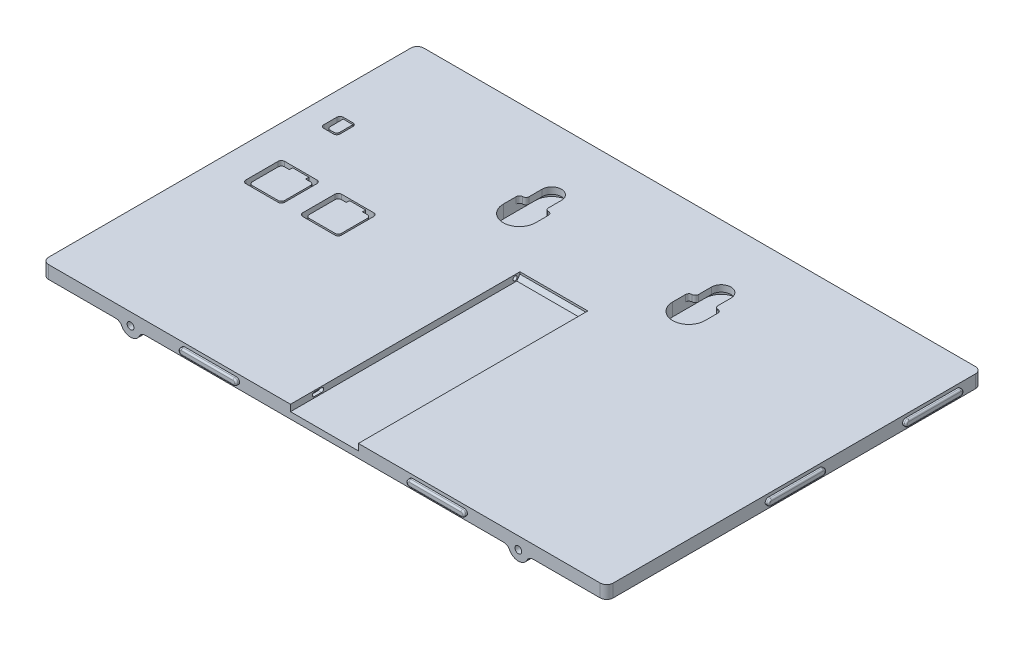
from build123d import *

# Parameters (mm, degrees)
BOSS_EXTRUDE1_DEPTH             = 4
FILLET1_R                       = 2
CUT_EXTRUDE1_DEPTH              = 2
SKETCH5_R                       = 3.0499999999999914
SKETCH5_R_2                     = 1.050000000000002
BOSS_EXTRUDE2_DEPTH             = 9
FILLET2_R                       = 2
CUT_EXTRUDE2_DEPTH              = 11
FILLET3_R                       = 2
FILLET2_OF_MIRROR1_R            = 2
FILLET3_OF_MIRROR1_R            = 2
CUT_EXTRUDE4_DEPTH              = 106.0829687697655
CUT_EXTRUDE6_START              = -4
CUT_EXTRUDE6_DEPTH              = 2.5
SKETCH6_5_R                     = 3.550000000000004
SKETCH6_5_R_2                   = 3.549999999999997
BOSS_EXTRUDE3_DEPTH             = 5.41
SKETCH6_6_W                     = 11.999999999999986
SKETCH6_6_H                     = 12
SKETCH6_6_W_2                   = 12
SKETCH6_6_H_2                   = 11.999999999999993
BOSS_EXTRUDE4_DEPTH             = 5.41
SKETCH6_7_W                     = 9.999999999999972
SKETCH6_7_H                     = 9.999999999999991
SKETCH6_7_R                     = 3.550000000000004
SKETCH6_7_W_2                   = 10
SKETCH6_7_H_2                   = 9.999999999999993
SKETCH6_7_R_2                   = 3.549999999999997
CUT_EXTRUDE9_DEPTH              = 0.5
FILLET4_R                       = 1
FILLET5_R                       = 0.25
CUT_EXTRUDE7_DEPTH              = 106.0829687697655
CUT_EXTRUDE8_START              = -2
SKETCH7_3_W                     = 2.999999999999986
SKETCH7_3_H                     = 1
CUT_EXTRUDE8_DEPTH              = 0.5
BOSS_EXTRUDE5_DEPTH             = 3.62
SKETCH7_5_W                     = 2.999999999999986
SKETCH7_5_H                     = 1
CUT_EXTRUDE10_DEPTH             = 0.5
SKETCH7_6_W                     = 7
SKETCH7_6_H                     = 8.000000000000007
SKETCH7_6_W_2                   = 5
SKETCH7_6_H_2                   = 6.000000000000007
BOSS_EXTRUDE6_DEPTH             = 3.62
FILLET6_START                   = -1
FILLET6_DEPTH                   = 3
FILLET6_START_2                 = 1.8288956
FILLET6_2_DEPTH                 = 1.78876
FILLET6_3_DEPTH                 = 0.6711044
FILLET6_START_3                 = 0.38
FILLET6_4_DEPTH                 = 3.62
FILLET7_R                       = 0.25
BOSS_EXTRUDE7_DEPTH             = 6
CUT_EXTRUDE11_DEPTH             = 4
CUT_EXTRUDE12_START             = -2
CUT_EXTRUDE12_DEPTH             = 2
FILLET8_R                       = 1
FILLET9_R                       = 2
FILLET8_OF_MIRROR2_R            = 1
FILLET9_OF_MIRROR2_R            = 2
CUT_EXTRUDE13_DEPTH             = 2
CUT_EXTRUDE14_START             = -10.5
SKETCH10_R                      = 0.6250000000000004
CUT_EXTRUDE14_DEPTH             = 1
CUT_EXTRUDE15_START             = 11.5
SKETCH10_2_R                    = 0.6250000000000004
CUT_EXTRUDE15_DEPTH             = 1
BOSS_EXTRUDE8_REACH             = 106.939
BOSS_EXTRUDE8_DIRECTION_2_REACH = 106.939
CUT_EXTRUDE16_START             = -10.5
CUT_EXTRUDE16_DEPTH             = 1
BOSS_EXTRUDE9_DEPTH             = 1
BOSS_EXTRUDE10_DEPTH            = 1
BOSS_EXTRUDE11_START            = 1
BOSS_EXTRUDE11_DEPTH            = 1
BOSS_EXTRUDE12_DEPTH            = 1
FILLET11_R                      = 0.5


with BuildPart() as part:
    # Sketch3 → Boss-Extrude1 (new body)
    with BuildSketch(Plane(origin=(0, 0, 0), x_dir=(1, 0, 0), z_dir=(0, 1, 0))):
        Polygon((-87.33750000000002, 58.0375), (87.33749999999999, 58.0375), (87.33750000000003, -58.037500000000016), (-87.33749999999999, -58.037500000000016), align=None)
    extrude(amount=BOSS_EXTRUDE1_DEPTH)

    # Fillet1
    fillet1_edges = [part.edges().sort_by_distance(p)[0] for p in [
        (87.33750000000003, 2, 58.037500000000016),
        (-87.33749999999999, 2, 58.037500000000016),
        (-87.33750000000002, 2, -58.0375),
        (87.33749999999999, 2, -58.0375),
    ]]
    fillet(fillet1_edges, radius=FILLET1_R)

    # Sketch4 → Cut-Extrude1 (cut)
    with BuildSketch(Plane(origin=(0, 0, 0), x_dir=(1, 0, 0), z_dir=(0, 1, 0))):
        with BuildLine():
            Line((-87.33750000000002, 41.2375), (-36.27500000000002, 41.2375))
            ThreePointArc((-36.27500000000002, 41.2375), (-35.52369904498932, 40.92630095501071), (-35.21250000000004, 40.17500000000001))
            Line((-35.21250000000004, 40.17500000000001), (-35.21250000000003, 14.299999999999981))
            ThreePointArc((-35.21250000000003, 14.299999999999981), (-35.523699044989314, 13.548699044989284), (-36.27500000000001, 13.237499999999995))
            Line((-36.27500000000001, 13.237499999999995), (-87.33750000000002, 13.237499999999995))
            Line((-87.33750000000002, 13.237499999999995), (-87.33750000000002, 41.2375))
        make_face()
    extrude(amount=CUT_EXTRUDE1_DEPTH, mode=Mode.SUBTRACT)

    # Sketch5 → Boss-Extrude2 (add)
    with BuildSketch(Plane.XY.offset(58.037500000000016)):
        with Locations((60, 0.2500000000000002)):
            Circle(SKETCH5_R)
        with Locations((60, 0.2500000000000002)):
            Circle(SKETCH5_R_2, mode=Mode.SUBTRACT)
    boss_extrude2 = extrude(amount=-BOSS_EXTRUDE2_DEPTH)

    # Fillet2
    # the kernel refuses this fillet: 2 mm, written as the material it adds along each edge
    with BuildSketch(Plane(origin=(63.980196097281436, 0, 49.037500000000016), x_dir=(0, 0, -1), z_dir=(-1, 0, 0))) as fillet2_piece_1_section:
        with BuildLine():
            CenterArc((FILLET2_R, FILLET2_R), FILLET2_R, 180, 90)
            Line((0, FILLET2_R), (0, 0))
            Line((0, 0), (FILLET2_R, 0))
        make_face()
    fillet2_piece_1 = extrude(amount=12.019932927995562, mode=Mode.PRIVATE)
    fillet2_piece_1 = fillet2_piece_1 & Plane(origin=(60, 0.2500000000000002, 49.037500000000016), x_dir=(1, 0, 0), z_dir=(0, 0, 1)) * Cylinder(3.0499999999999914, 33, mode=Mode.PRIVATE)
    fillet2_piece_1 = fillet2_piece_1 - Plane(origin=(60, 0.2500000000000002, 49.037500000000016), x_dir=(1, 0, 0), z_dir=(0, 0, 1)) * Cylinder(1.050000000000002, 33, mode=Mode.PRIVATE)
    add(fillet2_piece_1)
    with BuildSketch(Plane(origin=(68.03973683071413, 0, 49.037500000000016), x_dir=(0, 0, -1), z_dir=(-1, 0, 0))) as fillet2_piece_2_section:
        with BuildLine():
            CenterArc((FILLET2_R, FILLET2_R), FILLET2_R, 180, 90)
            Line((0, FILLET2_R), (0, 0))
            Line((0, 0), (FILLET2_R, 0))
        make_face()
    fillet2_piece_2 = extrude(amount=12.019932927995583, mode=Mode.PRIVATE)
    fillet2_piece_2 = fillet2_piece_2 - Plane(origin=(60, 0.2500000000000002, 49.037500000000016), x_dir=(1, 0, 0), z_dir=(0, 0, 1)) * Cylinder(1.050000000000002, 33, mode=Mode.PRIVATE)
    fillet2_piece_2 = fillet2_piece_2 & Plane(origin=(60, 0.2500000000000002, 49.037500000000016), x_dir=(1, 0, 0), z_dir=(0, 0, 1)) * Cylinder(3.0499999999999914, 33, mode=Mode.PRIVATE)
    add(fillet2_piece_2)

    # Sketch5<6> → Cut-Extrude2 (cut)
    with BuildSketch(Plane.XY.offset(58.037500000000016)):
        with BuildLine():
            ThreePointArc((61.01980390271856, 4.4e-16), (61.042423641772984, 0.12409149721818807), (61.050000000000004, 0.24999999999999997))
            ThreePointArc((61.050000000000004, 0.2500000000000002), (59.87409149721818, 1.2924236417729813), (58.98019609728144, -1.638e-14))
            Line((58.98019609728145, 0), (61.01980390271855, 0))
        make_face()
        with BuildLine():
            Line((61.01980390271855, 0), (58.98019609728145, 0))
            ThreePointArc((58.98019609728144, -1.638e-14), (60.00000000000001, -0.8000000000000018), (61.01980390271856, 4.4e-16))
        make_face()
    cut_extrude2 = extrude(amount=-CUT_EXTRUDE2_DEPTH, mode=Mode.SUBTRACT)

    # Fillet3
    fillet3_edges = [part.edges().sort_by_distance(p)[0] for p in [
        (56.960263169285945, -1.12e-14, 52.53750000000001),
        (63.03973683071405, -5.129e-14, 52.53750000000001),
    ]]
    fillet(fillet3_edges, radius=FILLET3_R)

    # Mirror1: Boss-Extrude2, Cut-Extrude2 across plane
    add(boss_extrude2.mirror(Plane(origin=(0, 0, 0), x_dir=(3e-16, 0, 1), z_dir=(1, 0, -3e-16))))
    add(cut_extrude2.mirror(Plane(origin=(0, 0, 0), x_dir=(3e-16, 0, 1), z_dir=(1, 0, -3e-16))), mode=Mode.SUBTRACT)

    # Fillet2 of Mirror1
    # the kernel refuses this fillet: 2 mm, written as the material it adds along each edge
    with BuildSketch(Plane(origin=(-63.980196097281414, 0, 49.03750000000006), x_dir=(0, -1, 0), z_dir=(1, 0, -6e-16))) as fillet2_of_mirror1_piece_1_section:
        with BuildLine():
            CenterArc((FILLET2_OF_MIRROR1_R, FILLET2_OF_MIRROR1_R), FILLET2_OF_MIRROR1_R, 180, 90)
            Line((0, FILLET2_OF_MIRROR1_R), (0, 0))
            Line((0, 0), (FILLET2_OF_MIRROR1_R, 0))
        make_face()
    fillet2_of_mirror1_piece_1 = extrude(amount=12.01993292799557, mode=Mode.PRIVATE)
    fillet2_of_mirror1_piece_1 = fillet2_of_mirror1_piece_1 - Plane(origin=(-60.000000000000234, 0.249999999999986, 49.03750000000006), x_dir=(-0.9712418121129005, -0.238095238095283, 0), z_dir=(6e-16, 0, 1)) * Cylinder(1.0499999999997416, 33, mode=Mode.PRIVATE)
    fillet2_of_mirror1_piece_1 = fillet2_of_mirror1_piece_1 & Plane(origin=(-59.99999999999997, 0.2500000000000002, 49.03750000000006), x_dir=(-1, 0, 6e-16), z_dir=(6e-16, 0, 1)) * Cylinder(3.0499999999999914, 33, mode=Mode.PRIVATE)
    add(fillet2_of_mirror1_piece_1)
    with BuildSketch(Plane(origin=(-68.0397368307141, 0, 49.03750000000006), x_dir=(0, -1, -3.55e-15), z_dir=(1, 0, -6e-16))) as fillet2_of_mirror1_piece_2_section:
        with BuildLine():
            CenterArc((FILLET2_OF_MIRROR1_R, FILLET2_OF_MIRROR1_R), FILLET2_OF_MIRROR1_R, 180, 89.99999999999977)
            Line((7.11e-15, FILLET2_OF_MIRROR1_R), (0, 0))
            Line((0, 0), (FILLET2_OF_MIRROR1_R, 0))
        make_face()
    fillet2_of_mirror1_piece_2 = extrude(amount=12.019932927995576, mode=Mode.PRIVATE)
    fillet2_of_mirror1_piece_2 = fillet2_of_mirror1_piece_2 - Plane(origin=(-60.000000000000234, 0.249999999999986, 49.03750000000005), x_dir=(-0.9712418121129005, -0.238095238095283, 0), z_dir=(6e-16, 0, 1)) * Cylinder(1.0499999999997416, 33, mode=Mode.PRIVATE)
    fillet2_of_mirror1_piece_2 = fillet2_of_mirror1_piece_2 & Plane(origin=(-59.99999999999997, 0.2500000000000002, 49.03750000000005), x_dir=(-1, 0, 6e-16), z_dir=(6e-16, 0, 1)) * Cylinder(3.0499999999999914, 33, mode=Mode.PRIVATE)
    add(fillet2_of_mirror1_piece_2)

    # Fillet3 of Mirror1
    fillet3_of_mirror1_edges = [part.edges().sort_by_distance(p)[0] for p in [
        (-56.960263169285916, -1.12e-14, 52.537500000000044),
        (-63.03973683071402, -5.129e-14, 52.537500000000044),
    ]]
    fillet(fillet3_of_mirror1_edges, radius=FILLET3_OF_MIRROR1_R)

    # Sketch6 → Cut-Extrude4 (cut, through all)
    with BuildSketch(Plane(origin=(0, 4, 0), x_dir=(1, 0, 0), z_dir=(0, 1, 0))):
        Polygon((-74.01750000000006, 6.152499999999987), (-77.51750000000003, 6.152499999999987), (-77.51750000000003, -5.847500000000013), (-65.51750000000004, -5.847500000000013), (-65.51750000000004, 6.152499999999987), (-69.01750000000004, 6.152499999999987), (-69.01750000000004, 5.152499999999988), (-66.51750000000006, 5.152499999999987), (-66.51750000000006, -4.847500000000004), (-76.51750000000003, -4.847500000000004), (-76.51750000000003, 5.152499999999987), (-74.01750000000006, 5.152499999999987), align=None)
        Polygon((-56.427500000000016, 6.152499999999982), (-59.92750000000002, 6.152499999999982), (-59.92750000000002, -5.847500000000013), (-47.92750000000002, -5.847500000000012), (-47.92750000000002, 6.152499999999982), (-51.42750000000003, 6.152499999999982), (-51.42750000000003, 5.152499999999985), (-48.92750000000002, 5.152499999999982), (-48.92750000000002, -4.847500000000011), (-58.92750000000002, -4.847500000000012), (-58.92750000000002, 5.152499999999982), (-56.427500000000016, 5.152499999999982), align=None)
    extrude(amount=-CUT_EXTRUDE4_DEPTH, mode=Mode.SUBTRACT)

    # Sketch6<4> → Cut-Extrude6 (cut)
    with BuildSketch(Plane(origin=(0, 4, 0), x_dir=(1, 0, 0), z_dir=(0, 1, 0)).offset(CUT_EXTRUDE6_START)):
        Polygon((-69.01750000000004, 6.152499999999987), (-74.01750000000006, 6.152499999999987), (-74.01750000000006, 5.1524999999999865), (-69.01750000000004, 5.152499999999987), align=None)
        Polygon((-51.42750000000003, 6.152499999999982), (-56.427500000000016, 6.152499999999982), (-56.427500000000016, 5.152499999999983), (-51.42750000000003, 5.152499999999982), align=None)
    extrude(amount=CUT_EXTRUDE6_DEPTH, mode=Mode.SUBTRACT)

    # Sketch6<5> → Boss-Extrude3 (add)
    with BuildSketch(Plane(origin=(0, 4, 0), x_dir=(1, 0, 0), z_dir=(0, 1, 0))):
        with Locations(Location((-71.51750000000004, 0.15249999999998598, 0), (0, 0, 270))):
            Circle(SKETCH6_5_R)
        with Locations(Location((-53.92750000000002, 0.15249999999998426, 0), (0, 0, 270))):
            Circle(SKETCH6_5_R_2)
    extrude(amount=-BOSS_EXTRUDE3_DEPTH)

    # Sketch6<6> → Boss-Extrude4 (add)
    # profile 1 of 2: a face of its own
    with BuildSketch(Plane(origin=(0, 4, 0), x_dir=(1, 0, 0), z_dir=(0, 1, 0))):
        Polygon((-64.51750000000003, 7.152499999999879), (-64.51750000000003, -6.847499999999877), (-78.51749999999994, -6.847499999999878), (-78.51749999999994, 7.152499999999879), align=None)
        with Locations((-71.51750000000004, 0.15249999999998787)):
            Rectangle(SKETCH6_6_W, SKETCH6_6_H, mode=Mode.SUBTRACT)
    # profile 2 of 2: a face of its own
    with BuildSketch(Plane(origin=(0, 4, 0), x_dir=(1, 0, 0), z_dir=(0, 1, 0))):
        Polygon((-46.92750000000002, 7.152499999999876), (-46.92750000000002, -6.847499999999877), (-60.92749999999995, -6.847499999999877), (-60.92749999999995, 7.152499999999877), align=None)
        with Locations((-53.92750000000002, 0.1524999999999852)):
            Rectangle(SKETCH6_6_W_2, SKETCH6_6_H_2, mode=Mode.SUBTRACT)
    extrude(amount=-BOSS_EXTRUDE4_DEPTH)

    # Sketch6<7> → Cut-Extrude9 (cut)
    # profile 1 of 6: a face of its own
    with BuildSketch(Plane(origin=(0, 4, 0), x_dir=(1, 0, 0), z_dir=(0, 1, 0))):
        with Locations((-71.51750000000004, 0.15249999999999186)):
            Rectangle(SKETCH6_7_W, SKETCH6_7_H)
        with Locations(Location((-71.51750000000004, 0.15249999999998598, 0), (0, 0, 270))):
            Circle(SKETCH6_7_R, mode=Mode.SUBTRACT)
    # profile 2 of 6: a face of its own
    with BuildSketch(Plane(origin=(0, 4, 0), x_dir=(1, 0, 0), z_dir=(0, 1, 0))):
        with Locations(Location((-71.51750000000004, 0.15249999999998598, 0), (0, 0, 270))):
            Circle(SKETCH6_7_R)
    # profile 3 of 6: a face of its own
    with BuildSketch(Plane(origin=(0, 4, 0), x_dir=(1, 0, 0), z_dir=(0, 1, 0))):
        with Locations((-53.92750000000002, 0.1524999999999852)):
            Rectangle(SKETCH6_7_W_2, SKETCH6_7_H_2)
        with Locations(Location((-53.92750000000002, 0.15249999999998426, 0), (0, 0, 270))):
            Circle(SKETCH6_7_R_2, mode=Mode.SUBTRACT)
    # profile 4 of 6: a face of its own
    with BuildSketch(Plane(origin=(0, 4, 0), x_dir=(1, 0, 0), z_dir=(0, 1, 0))):
        with Locations(Location((-53.92750000000002, 0.15249999999998426, 0), (0, 0, 270))):
            Circle(SKETCH6_7_R_2)
    # profile 5 of 6: a face of its own
    with BuildSketch(Plane(origin=(0, 4, 0), x_dir=(1, 0, 0), z_dir=(0, 1, 0))):
        Polygon((-51.42750000000003, 6.152499999999982), (-56.427500000000016, 6.152499999999982), (-56.427500000000016, 5.152499999999983), (-51.42750000000003, 5.152499999999982), align=None)
    # profile 6 of 6: a face of its own
    with BuildSketch(Plane(origin=(0, 4, 0), x_dir=(1, 0, 0), z_dir=(0, 1, 0))):
        Polygon((-69.01750000000004, 6.152499999999987), (-74.01750000000006, 6.152499999999987), (-74.01750000000006, 5.1524999999999865), (-69.01750000000004, 5.152499999999987), align=None)
    extrude(amount=-CUT_EXTRUDE9_DEPTH, mode=Mode.SUBTRACT)

    # Fillet4
    fillet4_edges = [part.edges().sort_by_distance(p)[0] for p in [
        (-76.51750000000003, 1.75, -5.152499999999987),
        (-76.51750000000003, 1.75, 4.847500000000004),
        (-66.51750000000006, 1.75, 4.847500000000004),
        (-66.51750000000006, 1.75, -5.152499999999987),
        (-65.51750000000004, 1.295, -6.152499999999987),
        (-65.51750000000004, 1.295, 5.847500000000013),
        (-77.51750000000003, 1.295, 5.847500000000013),
        (-77.51750000000003, 1.295, -6.152499999999987),
        (-47.92750000000002, 1.295, -6.152499999999982),
        (-47.92750000000002, 1.295, 5.847500000000011),
        (-59.92750000000002, 1.295, 5.847500000000013),
        (-59.92750000000002, 1.295, -6.152499999999982),
        (-58.92750000000002, 1.75, -5.152499999999982),
        (-58.92750000000002, 1.75, 4.847500000000011),
        (-48.92750000000002, 1.75, 4.847500000000011),
        (-48.92750000000002, 1.75, -5.152499999999982),
        (-64.51750000000003, -0.7050000000000001, -7.152499999999879),
        (-64.51750000000003, -0.7050000000000001, 6.847499999999877),
        (-78.51749999999994, -0.7050000000000001, 6.847499999999878),
        (-78.51749999999994, -0.7050000000000001, -7.152499999999879),
        (-46.92750000000002, -0.7050000000000001, -7.152499999999876),
        (-46.92750000000002, -0.7050000000000001, 6.847499999999877),
        (-60.92749999999995, -0.7050000000000001, 6.847499999999877),
        (-60.92749999999995, -0.7050000000000001, -7.152499999999877),
    ]]
    fillet(fillet4_edges, radius=FILLET4_R)

    # Fillet5
    fillet5_edges = [part.edges().sort_by_distance(p)[0] for p in [
        (-71.51750000000004, -1.4100000000000001, -3.70249999999999),
        (-53.92750000000002, -1.4100000000000001, -3.7024999999999815),
    ]]
    fillet(fillet5_edges, radius=FILLET5_R)

    # Sketch7 → Cut-Extrude7 (cut, through all)
    with BuildSketch(Plane(origin=(0, 4, 0), x_dir=(1, 0, 0), z_dir=(0, 1, 0))):
        Polygon((-79.25750000000002, 22.037499999999994), (-79.25750000000002, 26.037499999999998), (-79.25750000000002, 27.037499999999994), (-80.25750000000004, 27.037499999999994), (-80.25750000000004, 21.03749999999999), (-75.25750000000004, 21.03749999999999), (-75.25750000000004, 27.037499999999994), (-76.25750000000004, 27.037499999999994), (-76.25750000000004, 26.037499999999998), (-76.25750000000002, 22.03749999999999), align=None)
    extrude(amount=-CUT_EXTRUDE7_DEPTH, mode=Mode.SUBTRACT)

    # Sketch7<3> → Cut-Extrude8 (cut)
    with BuildSketch(Plane(origin=(0, 4, 0), x_dir=(1, 0, 0), z_dir=(0, 1, 0)).offset(CUT_EXTRUDE8_START)):
        with Locations((-77.75750000000002, 26.537499999999998)):
            Rectangle(SKETCH7_3_W, SKETCH7_3_H)
    extrude(amount=CUT_EXTRUDE8_DEPTH, mode=Mode.SUBTRACT)

    # Sketch7<4> → Boss-Extrude5 (add)
    with BuildSketch(Plane(origin=(0, 4, 0), x_dir=(1, 0, 0), z_dir=(0, 1, 0))):
        Polygon((-76.25750000000004, 26.037499999999998), (-76.25750000000002, 22.03749999999999), (-79.25750000000002, 22.037499999999994), (-79.25750000000002, 26.037499999999998), align=None)
    extrude(amount=-BOSS_EXTRUDE5_DEPTH)

    # Sketch7<5> → Cut-Extrude10 (cut)
    with BuildSketch(Plane(origin=(0, 4, 0), x_dir=(1, 0, 0), z_dir=(0, 1, 0))):
        Polygon((-76.25750000000004, 26.037499999999998), (-76.25750000000002, 22.03749999999999), (-79.25750000000002, 22.037499999999994), (-79.25750000000002, 26.037499999999998), align=None)
        with Locations((-77.75750000000002, 26.537499999999998)):
            Rectangle(SKETCH7_5_W, SKETCH7_5_H)
    extrude(amount=-CUT_EXTRUDE10_DEPTH, mode=Mode.SUBTRACT)

    # Sketch7<6> → Boss-Extrude6 (add)
    with BuildSketch(Plane(origin=(0, 4, 0), x_dir=(1, 0, 0), z_dir=(0, 1, 0))):
        with Locations((-77.75750000000004, 24.037499999999994)):
            Rectangle(SKETCH7_6_W, SKETCH7_6_H)
        with Locations((-77.75750000000004, 24.037499999999994)):
            Rectangle(SKETCH7_6_W_2, SKETCH7_6_H_2, mode=Mode.SUBTRACT)
    extrude(amount=-BOSS_EXTRUDE6_DEPTH)

    # Fillet6: read off the stored shape, not the designer's step
    # Fillet6 outline → Fillet6 (cut)
    with BuildSketch(Plane(origin=(0, 0, 0), x_dir=(1, 0, 0), z_dir=(0, 1, 0)).offset(FILLET6_START)):
        with BuildLine():
            Line((-76.2575, 26.0375), (-77.2575, 26.0375))
            ThreePointArc((-77.2575, 26.0375), (-76.550393219, 25.744606781), (-76.2575, 25.0375))
            Line((-76.2575, 25.0375), (-76.2575, 26.0375))
        make_face()
        with BuildLine():
            ThreePointArc((-79.2575, 25.0375), (-78.964606781, 25.744606781), (-78.2575, 26.0375))
            Line((-78.2575, 26.0375), (-79.2575, 26.0375))
            Line((-79.2575, 26.0375), (-79.2575, 25.0375))
        make_face()
        with BuildLine():
            Line((-76.2575, 22.0375), (-76.2575, 23.0375))
            ThreePointArc((-76.2575, 23.0375), (-76.550393219, 22.330393219), (-77.2575, 22.0375))
            Line((-77.2575, 22.0375), (-76.2575, 22.0375))
        make_face()
        with BuildLine():
            ThreePointArc((-78.2575, 22.0375), (-78.964606781, 22.330393219), (-79.2575, 23.0375))
            Line((-79.2575, 23.0375), (-79.2575, 22.0375))
            Line((-79.2575, 22.0375), (-78.2575, 22.0375))
        make_face()
        with BuildLine():
            Line((-74.2575, 20.0375), (-74.2575, 21.0375))
            ThreePointArc((-74.2575, 21.0375), (-74.550393219, 20.330393219), (-75.2575, 20.0375))
            Line((-75.2575, 20.0375), (-74.2575, 20.0375))
        make_face()
        with BuildLine():
            ThreePointArc((-75.2575, 28.0375), (-74.550393219, 27.744606781), (-74.2575, 27.0375))
            Line((-74.2575, 27.0375), (-74.2575, 28.0375))
            Line((-74.2575, 28.0375), (-75.2575, 28.0375))
        make_face()
        with BuildLine():
            Line((-81.2575, 20.0375), (-80.2575, 20.0375))
            ThreePointArc((-80.2575, 20.0375), (-80.964606781, 20.330393219), (-81.2575, 21.0375))
            Line((-81.2575, 21.0375), (-81.2575, 20.0375))
        make_face()
        with BuildLine():
            ThreePointArc((-81.2575, 27.0375), (-80.964606781, 27.744606781), (-80.2575, 28.0375))
            Line((-80.2575, 28.0375), (-81.2575, 28.0375))
            Line((-81.2575, 28.0375), (-81.2575, 27.0375))
        make_face()
    extrude(amount=FILLET6_DEPTH, mode=Mode.SUBTRACT)

    # Fillet6 2 outline → Fillet6 2 (cut)
    with BuildSketch(Plane(origin=(0, 0, 0), x_dir=(1, 0, 0), z_dir=(0, 1, 0)).offset(FILLET6_START_2)):
        with BuildLine():
            Line((-76.2575, 22.0375), (-76.2575, 23.0375))
            ThreePointArc((-76.2575, 23.0375), (-76.550393219, 22.330393219), (-77.2575, 22.0375))
            Line((-77.2575, 22.0375), (-76.2575, 22.0375))
        make_face()
        with BuildLine():
            ThreePointArc((-78.2575, 22.0375), (-78.964606781, 22.330393219), (-79.2575, 23.0375))
            Line((-79.2575, 23.0375), (-79.2575, 22.0375))
            Line((-79.2575, 22.0375), (-78.2575, 22.0375))
        make_face()
    extrude(amount=FILLET6_2_DEPTH, mode=Mode.SUBTRACT)

    # Fillet6 3 outline → Fillet6 3 (cut)
    with BuildSketch(Plane(origin=(0, 0, 0), x_dir=(1, 0, 0), z_dir=(0, 1, 0)).offset(FILLET6_START_2)):
        with BuildLine():
            Line((-76.2575, 26.0375), (-77.2575, 26.0375))
            ThreePointArc((-77.2575, 26.0375), (-76.550393219, 25.744606781), (-76.2575, 25.0375))
            Line((-76.2575, 25.0375), (-76.2575, 26.0375))
        make_face()
        with BuildLine():
            ThreePointArc((-79.2575, 25.0375), (-78.964606781, 25.744606781), (-78.2575, 26.0375))
            Line((-78.2575, 26.0375), (-79.2575, 26.0375))
            Line((-79.2575, 26.0375), (-79.2575, 25.0375))
        make_face()
    extrude(amount=FILLET6_3_DEPTH, mode=Mode.SUBTRACT)

    # Fillet6 4 outline → Fillet6 4 (add)
    with BuildSketch(Plane(origin=(0, 0, 0), x_dir=(1, 0, 0), z_dir=(0, 1, 0)).offset(FILLET6_START_3)):
        with BuildLine():
            Line((-75.2575, 27.0375), (-76.2575, 27.0375))
            ThreePointArc((-76.2575, 27.0375), (-75.550393219, 26.744606781), (-75.2575, 26.0375))
            Line((-75.2575, 26.0375), (-75.2575, 27.0375))
        make_face()
        with BuildLine():
            ThreePointArc((-80.2575, 26.0375), (-79.964606781, 26.744606781), (-79.2575, 27.0375))
            Line((-79.2575, 27.0375), (-80.2575, 27.0375))
            Line((-80.2575, 27.0375), (-80.2575, 26.0375))
        make_face()
        with BuildLine():
            Line((-75.2575, 21.0375), (-75.2575, 22.0375))
            ThreePointArc((-75.2575, 22.0375), (-75.550393219, 21.330393219), (-76.2575, 21.0375))
            Line((-76.2575, 21.0375), (-75.2575, 21.0375))
        make_face()
        with BuildLine():
            ThreePointArc((-79.2575, 21.0375), (-79.964606781, 21.330393219), (-80.2575, 22.0375))
            Line((-80.2575, 22.0375), (-80.2575, 21.0375))
            Line((-80.2575, 21.0375), (-79.2575, 21.0375))
        make_face()
    extrude(amount=FILLET6_4_DEPTH)

    # Fillet7
    fillet7_edges = [part.edges().sort_by_distance(p)[0] for p in [
        (-77.7575, 0.3799999999999999, -26.037499999999998),
        (-76.25750000000004, 0.3799999999999999, -24.0375),
        (-77.7575, 0.3799999999999999, -22.03749999999999),
        (-79.25750000000002, 0.3799999999999999, -24.0375),
        (-78.964606781, 0.3799999999999999, -22.330393218999998),
        (-76.550393219, 0.3799999999999999, -22.330393219000005),
        (-78.964606781, 0.3799999999999999, -25.744606781000005),
        (-76.550393219, 0.3799999999999999, -25.744606780999998),
    ]]
    fillet(fillet7_edges, radius=FILLET7_R)

    # Sketch8 → Boss-Extrude7 (add)
    # profile 1 of 5: a face of its own
    with BuildSketch(Plane(origin=(0, 4, 0), x_dir=(1, 0, 0), z_dir=(0, 1, 0))):
        with BuildLine():
            Line((-33.212500000000034, 38.5115161094887), (-33.212500000000034, 28.511516109488696))
            ThreePointArc((-33.212500000000034, 28.511516109488696), (-26.212499999999995, 21.511516109488657), (-19.21249999999996, 28.511516109488696))
            Line((-19.21249999999996, 28.511516109488696), (-19.21249999999996, 38.5115161094887))
            ThreePointArc((-19.21249999999996, 38.5115161094887), (-26.212499999999995, 45.51151610948874), (-33.212500000000034, 38.5115161094887))
        make_face()
        with BuildLine():
            ThreePointArc((-31.212499999999995, 28.511516109488696), (-26.212499999999995, 23.511516109488696), (-21.2125, 28.511516109488696))
            Line((-21.2125, 28.511516109488696), (-21.2125, 38.5115161094887))
            ThreePointArc((-21.2125, 38.5115161094887), (-26.2125, 43.511516109488696), (-31.212499999999995, 38.511516109488696))
            Line((-31.212499999999995, 38.511516109488696), (-31.212499999999995, 28.511516109488696))
        make_face(mode=Mode.SUBTRACT)
    # profile 2 of 5: a face of its own
    with BuildSketch(Plane(origin=(0, 4, 0), x_dir=(1, 0, 0), z_dir=(0, 1, 0))):
        with BuildLine():
            Line((-21.2125, 33.5115161094887), (-21.2125, 38.5115161094887))
            ThreePointArc((-21.212499999999995, 38.5115161094887), (-26.2125, 43.511516109488696), (-31.212499999999995, 38.511516109488696))
            Line((-31.212499999999995, 38.511516109488696), (-31.212499999999995, 33.5115161094887))
            Line((-31.212499999999995, 33.5115161094887), (-29.2125, 33.5115161094887))
            Line((-29.2125, 33.5115161094887), (-29.2125, 38.5115161094887))
            ThreePointArc((-29.2125, 38.5115161094887), (-26.2125, 41.5115161094887), (-23.2125, 38.5115161094887))
            Line((-23.212499999999995, 38.5115161094887), (-23.212499999999995, 33.5115161094887))
            Line((-23.212499999999995, 33.5115161094887), (-21.2125, 33.5115161094887))
        make_face()
    # profile 3 of 5: a face of its own
    with BuildSketch(Plane(origin=(0, 4, 0), x_dir=(1, 0, 0), z_dir=(0, 1, 0))):
        with BuildLine():
            Line((-29.2125, 33.5115161094887), (-23.212499999999995, 33.5115161094887))
            Line((-23.212499999999995, 33.5115161094887), (-23.212499999999995, 38.5115161094887))
            ThreePointArc((-23.2125, 38.5115161094887), (-26.2125, 41.5115161094887), (-29.2125, 38.5115161094887))
            Line((-29.2125, 38.5115161094887), (-29.2125, 33.5115161094887))
        make_face()
    # profile 4 of 5: a face of its own
    with BuildSketch(Plane(origin=(0, 4, 0), x_dir=(1, 0, 0), z_dir=(0, 1, 0))):
        with BuildLine():
            Line((-23.212499999999995, 28.511516109488696), (-23.212499999999995, 33.5115161094887))
            Line((-23.212499999999995, 33.5115161094887), (-29.2125, 33.5115161094887))
            Line((-29.2125, 33.5115161094887), (-29.2125, 28.511516109488696))
            ThreePointArc((-29.212500000000002, 28.511516109488696), (-26.2125, 25.511516109488692), (-23.212499999999995, 28.511516109488696))
        make_face()
    # profile 5 of 5: a face of its own
    with BuildSketch(Plane(origin=(0, 4, 0), x_dir=(1, 0, 0), z_dir=(0, 1, 0))):
        with BuildLine():
            Line((-21.2125, 28.511516109488696), (-21.2125, 33.5115161094887))
            Line((-21.2125, 33.5115161094887), (-23.212499999999995, 33.5115161094887))
            Line((-23.212499999999995, 33.5115161094887), (-23.212499999999995, 28.511516109488696))
            ThreePointArc((-23.212499999999995, 28.511516109488696), (-26.2125, 25.511516109488692), (-29.212500000000002, 28.511516109488696))
            Line((-29.2125, 28.511516109488696), (-29.2125, 33.5115161094887))
            Line((-29.2125, 33.5115161094887), (-31.212499999999995, 33.5115161094887))
            Line((-31.212499999999995, 33.5115161094887), (-31.212499999999995, 28.511516109488696))
            ThreePointArc((-31.212499999999995, 28.511516109488696), (-26.2125, 23.511516109488696), (-21.212500000000002, 28.511516109488696))
        make_face()
    boss_extrude7 = extrude(amount=-BOSS_EXTRUDE7_DEPTH)

    # Sketch8<4> → Cut-Extrude11 (cut)
    with BuildSketch(Plane(origin=(0, 4, 0), x_dir=(1, 0, 0), z_dir=(0, 1, 0))):
        with BuildLine():
            Line((-23.212499999999995, 28.511516109488696), (-23.212499999999995, 33.5115161094887))
            Line((-23.212499999999995, 33.5115161094887), (-29.2125, 33.5115161094887))
            Line((-29.2125, 33.5115161094887), (-29.2125, 28.511516109488696))
            ThreePointArc((-29.212500000000002, 28.511516109488696), (-26.2125, 25.511516109488692), (-23.212499999999995, 28.511516109488696))
        make_face()
        with BuildLine():
            Line((-21.2125, 28.511516109488696), (-21.2125, 33.5115161094887))
            Line((-21.2125, 33.5115161094887), (-23.212499999999995, 33.5115161094887))
            Line((-23.212499999999995, 33.5115161094887), (-23.212499999999995, 28.511516109488696))
            ThreePointArc((-23.212499999999995, 28.511516109488696), (-26.2125, 25.511516109488692), (-29.212500000000002, 28.511516109488696))
            Line((-29.2125, 28.511516109488696), (-29.2125, 33.5115161094887))
            Line((-29.2125, 33.5115161094887), (-31.212499999999995, 33.5115161094887))
            Line((-31.212499999999995, 33.5115161094887), (-31.212499999999995, 28.511516109488696))
            ThreePointArc((-31.212499999999995, 28.511516109488696), (-26.2125, 23.511516109488696), (-21.212500000000002, 28.511516109488696))
        make_face()
        with BuildLine():
            Line((-29.2125, 33.5115161094887), (-23.212499999999995, 33.5115161094887))
            Line((-23.212499999999995, 33.5115161094887), (-23.212499999999995, 38.5115161094887))
            ThreePointArc((-23.2125, 38.5115161094887), (-26.2125, 41.5115161094887), (-29.2125, 38.5115161094887))
            Line((-29.2125, 38.5115161094887), (-29.2125, 33.5115161094887))
        make_face()
    cut_extrude11 = extrude(amount=-CUT_EXTRUDE11_DEPTH, mode=Mode.SUBTRACT)

    # Sketch8<5> → Cut-Extrude12 (cut)
    with BuildSketch(Plane(origin=(0, 4, 0), x_dir=(1, 0, 0), z_dir=(0, 1, 0)).offset(CUT_EXTRUDE12_START)):
        with BuildLine():
            Line((-21.2125, 33.5115161094887), (-21.2125, 38.5115161094887))
            ThreePointArc((-21.212499999999995, 38.5115161094887), (-26.2125, 43.511516109488696), (-31.212499999999995, 38.511516109488696))
            Line((-31.212499999999995, 38.511516109488696), (-31.212499999999995, 33.5115161094887))
            Line((-31.212499999999995, 33.5115161094887), (-29.2125, 33.5115161094887))
            Line((-29.2125, 33.5115161094887), (-29.2125, 38.5115161094887))
            ThreePointArc((-29.2125, 38.5115161094887), (-26.2125, 41.5115161094887), (-23.2125, 38.5115161094887))
            Line((-23.212499999999995, 38.5115161094887), (-23.212499999999995, 33.5115161094887))
            Line((-23.212499999999995, 33.5115161094887), (-21.2125, 33.5115161094887))
        make_face()
        with BuildLine():
            Line((-29.2125, 33.5115161094887), (-23.212499999999995, 33.5115161094887))
            Line((-23.212499999999995, 33.5115161094887), (-23.212499999999995, 38.5115161094887))
            ThreePointArc((-23.2125, 38.5115161094887), (-26.2125, 41.5115161094887), (-29.2125, 38.5115161094887))
            Line((-29.2125, 38.5115161094887), (-29.2125, 33.5115161094887))
        make_face()
    cut_extrude12 = extrude(amount=-CUT_EXTRUDE12_DEPTH, mode=Mode.SUBTRACT)

    # Fillet8
    fillet8_edges = [part.edges().sort_by_distance(p)[0] for p in [
        (-21.2125, 3, -33.5115161094887),
        (-31.212499999999995, 3, -33.5115161094887),
    ]]
    fillet(fillet8_edges, radius=FILLET8_R)
    fillet8_2_edges = [part.edges().sort_by_distance(p)[0] for p in [
        (-23.212499999999995, 3, -33.5115161094887),
        (-29.2125, 3, -33.5115161094887),
    ]]
    fillet(fillet8_2_edges, radius=FILLET8_R - 0.0001)  # a hair under: the kernel refuses the full size

    # Fillet9
    fillet9_edges = [part.edges().sort_by_distance(p)[0] for p in [
        (-26.212499999999995, 0, -45.51151610948874),
        (-19.21249999999996, 0, -33.511516109488696),
        (-26.212499999999995, 0, -21.511516109488657),
        (-33.212500000000034, 0, -33.511516109488696),
    ]]
    fillet(fillet9_edges, radius=FILLET9_R - 0.0001)  # a hair under: the kernel refuses the full size

    # Mirror2: Boss-Extrude7, Cut-Extrude11, Cut-Extrude12 across plane
    add(boss_extrude7.mirror(Plane.ZY))
    add(cut_extrude11.mirror(Plane.ZY), mode=Mode.SUBTRACT)
    add(cut_extrude12.mirror(Plane.ZY), mode=Mode.SUBTRACT)

    # Fillet8 of Mirror2
    fillet8_of_mirror2_edges = [part.edges().sort_by_distance(p)[0] for p in [
        (21.212499999999977, 3, -33.51151610948872),
        (31.212499999999974, 3, -33.511516109488724),
    ]]
    fillet(fillet8_of_mirror2_edges, radius=FILLET8_OF_MIRROR2_R)
    fillet8_of_mirror2_2_edges = [part.edges().sort_by_distance(p)[0] for p in [
        (23.212499999999974, 3, -33.51151610948872),
        (29.212499999999977, 3, -33.51151610948872),
    ]]
    fillet(fillet8_of_mirror2_2_edges, radius=FILLET8_OF_MIRROR2_R - 0.0001)  # a hair under: the kernel refuses the full size

    # Fillet9 of Mirror2
    fillet9_of_mirror2_edges = [part.edges().sort_by_distance(p)[0] for p in [
        (26.21249999999997, 0, -45.51151610948875),
        (19.212499999999938, 0, -33.51151610948871),
        (26.212499999999984, 0, -21.51151610948867),
        (33.21250000000001, 0, -33.511516109488724),
    ]]
    fillet(fillet9_of_mirror2_edges, radius=FILLET9_OF_MIRROR2_R - 0.0001)  # a hair under: the kernel refuses the full size

    # Sketch9 → Cut-Extrude13 (cut)
    with BuildSketch(Plane(origin=(0, 4, 0), x_dir=(1, 0, 0), z_dir=(0, 1, 0))):
        Polygon((-10.500000000000007, 12.96249999999998), (10.499999999999993, 12.96249999999998), (10.500000000000005, -58.037500000000016), (-10.499999999999998, -58.037500000000016), align=None)
    extrude(amount=-CUT_EXTRUDE13_DEPTH, mode=Mode.SUBTRACT)

    # Sketch10 → Cut-Extrude14 (cut)
    with BuildSketch(Plane.ZY.offset(CUT_EXTRUDE14_START)):
        with Locations(Location((-11.462499999999977, 3, 0), (0, 0, 180))):
            Circle(SKETCH10_R)
    extrude(amount=-CUT_EXTRUDE14_DEPTH, mode=Mode.SUBTRACT)

    # Sketch10<2> → Cut-Extrude15 (cut)
    with BuildSketch(Plane.ZY.offset(CUT_EXTRUDE15_START)):
        with Locations(Location((-11.462499999999977, 3, 0), (0, 0, 180))):
            Circle(SKETCH10_2_R)
    extrude(amount=-CUT_EXTRUDE15_DEPTH, mode=Mode.SUBTRACT)

    # Boss-Extrude8: up to this face of the body (flat: up to its plane)
    boss_extrude8_end = Plane(part.part.faces().sort_by_distance((10.5, 3, 22.833894423))[0])
    # Sketch11 → Boss-Extrude8 (add, up to the picked face)
    with BuildSketch(Plane.ZY, mode=Mode.PRIVATE) as boss_extrude8_sk1:
        Polygon((-12.962499999999977, 2), (-11.972499999999979, 1.9999999999999996), (-12.962499999999977, 3.3600000000000003), align=None)
    boss_extrude8_tool1 = split(extrude(boss_extrude8_sk1.sketch, amount=-BOSS_EXTRUDE8_REACH, mode=Mode.PRIVATE), bisect_by=boss_extrude8_end, keep=Keep.BOTH, mode=Mode.PRIVATE)
    add(boss_extrude8_tool1.solids().sort_by(Axis((0, 2.453333, -12.6325), (1, 0, -3e-16)))[0])

    # Boss-Extrude8 direction 2: up to this face of the body (flat: up to its plane)
    boss_extrude8_direction_2_end = Plane(part.part.faces().sort_by_distance((-10.5, 3, 22.833894423))[0])
    # Sketch11 → Boss-Extrude8 direction 2 (add, up to the picked face)
    with BuildSketch(Plane.ZY, mode=Mode.PRIVATE) as boss_extrude8_direction_2_sk1:
        Polygon((-12.962499999999977, 2), (-11.972499999999979, 1.9999999999999996), (-12.962499999999977, 3.3600000000000003), align=None)
    boss_extrude8_direction_2_tool1 = split(extrude(boss_extrude8_direction_2_sk1.sketch, amount=BOSS_EXTRUDE8_DIRECTION_2_REACH, mode=Mode.PRIVATE), bisect_by=boss_extrude8_direction_2_end, keep=Keep.BOTH, mode=Mode.PRIVATE)
    add(boss_extrude8_direction_2_tool1.solids().sort_by(Axis((0, 2.453333, -12.6325), (-1, 0, 3e-16)))[0])

    # Sketch12 → Cut-Extrude16 (cut)
    with BuildSketch(Plane.ZY.offset(CUT_EXTRUDE16_START)):
        with BuildLine():
            Line((50.66250000000002, 2.3749999999999996), (48.412500000000016, 2.3749999999999987))
            ThreePointArc((48.412500000000016, 2.3749999999999987), (47.787500000000016, 2.9999999999999987), (48.412500000000016, 3.624999999999999))
            Line((48.412500000000016, 3.624999999999999), (50.66250000000002, 3.625))
            ThreePointArc((50.66250000000002, 3.625), (51.28750000000002, 2.9999999999999996), (50.66250000000002, 2.3749999999999996))
        make_face()
    cut_extrude16 = extrude(amount=-CUT_EXTRUDE16_DEPTH, mode=Mode.SUBTRACT)

    # Mirror4: Cut-Extrude16 across plane
    add(cut_extrude16.mirror(Plane.ZY), mode=Mode.SUBTRACT)

    # Sketch13 → Boss-Extrude9 (add)
    with BuildSketch(Plane(origin=(0, 0, -58.0375), x_dir=(-1, 0, 0), z_dir=(0, 0, -1))):
        with BuildLine():
            Line((-8, 3), (8, 3))
            ThreePointArc((8, 3), (9, 2), (8, 1))
            Line((8, 1), (-8, 1))
            ThreePointArc((-8, 1), (-9, 2), (-8, 3))
        make_face()
        with BuildLine():
            Line((52, 3), (68, 3))
            ThreePointArc((68, 3), (69, 2), (68, 1))
            Line((68, 1), (52, 1))
            ThreePointArc((52, 1), (51, 2), (52, 3))
        make_face()
        with BuildLine():
            Line((-68, 2.9999999999995812), (-52, 2.9999999999995812))
            ThreePointArc((-52, 2.9999999999995812), (-51, 1.999999999999581), (-52, 0.9999999999995811))
            Line((-52, 0.9999999999995811), (-68, 0.9999999999995811))
            ThreePointArc((-68, 0.9999999999995811), (-69, 1.9999999999995812), (-68, 2.9999999999995812))
        make_face()
    extrude(amount=BOSS_EXTRUDE9_DEPTH)

    # Sketch14 → Boss-Extrude10 (add)
    with BuildSketch(Plane(origin=(87.3375, 0, -3.133e-14), x_dir=(-3.6e-16, 0, -1), z_dir=(1, 0, -3.6e-16))):
        with BuildLine():
            Line((-8, 3), (8, 3))
            ThreePointArc((8, 3), (9, 2), (8, 1))
            Line((8, 1), (-8, 1))
            ThreePointArc((-8, 1), (-9, 2), (-8, 3))
        make_face()
        with BuildLine():
            Line((34.5, 3), (50.5, 3))
            ThreePointArc((50.5, 3), (51.5, 2), (50.5, 1))
            Line((50.5, 1), (34.5, 1))
            ThreePointArc((34.5, 1), (33.5, 2), (34.5, 3))
        make_face()
    extrude(amount=BOSS_EXTRUDE10_DEPTH)

    # Sketch15 → Boss-Extrude11 (add)
    with BuildSketch(Plane.ZY.offset(87.3375).offset(BOSS_EXTRUDE11_START)):
        with BuildLine():
            Line((-8.00000000000001, 3), (7.999999999999989, 3))
            ThreePointArc((7.999999999999989, 3), (8.99999999999999, 2), (7.999999999999989, 1))
            Line((7.999999999999989, 1), (-8.00000000000001, 1))
            ThreePointArc((-8.00000000000001, 1), (-9.00000000000001, 2), (-8.00000000000001, 3))
        make_face()
        with BuildLine():
            Line((-50.500000000000014, 3), (-41.237500000000004, 3))
            Line((-41.237500000000004, 3), (-41.237500000000004, 1))
            Line((-41.237500000000004, 1), (-50.500000000000014, 1))
            ThreePointArc((-50.500000000000014, 1), (-51.500000000000014, 2), (-50.500000000000014, 3))
        make_face()
    extrude(amount=-BOSS_EXTRUDE11_DEPTH)

    # Sketch16 → Boss-Extrude12 (add)
    with BuildSketch(Plane.XY.offset(58.037500000000016)):
        with BuildLine():
            Line((27.249999999999996, 3), (43.25, 3))
            ThreePointArc((43.25, 3), (44.25, 2), (43.25, 1))
            Line((43.25, 1), (27.249999999999996, 1))
            ThreePointArc((27.249999999999996, 1), (26.249999999999996, 2), (27.249999999999996, 3))
        make_face()
        with BuildLine():
            Line((-27.24999999999999, 2.9999999999996696), (-43.25, 2.999999999999475))
            ThreePointArc((-43.25, 2.999999999999475), (-44.249999999999986, 1.9999999999994609), (-43.24999999999997, 0.9999999999994749))
            Line((-43.24999999999997, 0.9999999999994749), (-27.249999999999968, 0.9999999999996692))
            ThreePointArc((-27.249999999999968, 0.9999999999996692), (-26.249999999999975, 1.9999999999996803), (-27.24999999999999, 2.9999999999996696))
        make_face()
    extrude(amount=BOSS_EXTRUDE12_DEPTH)

    # Fillet11
    fillet11_edges = [part.edges().sort_by_distance(p)[0] for p in [
        (9, 2, -59.0375),
        (0, 1, -59.0375),
        (-9, 2, -59.0375),
        (0, 3, -59.0375),
        (-51, 2, -59.0375),
        (-60, 1, -59.0375),
        (-69, 2, -59.0375),
        (-60, 3, -59.0375),
        (69, 1.9999999999995812, -59.0375),
        (60, 0.9999999999995811, -59.0375),
        (51, 1.9999999999995812, -59.0375),
        (60, 2.9999999999995812, -59.0375),
        (88.3375, 2, 8.999999999999968),
        (88.3375, 1, -3.168e-14),
        (88.3375, 2, -9.000000000000032),
        (88.3375, 3, -3.168e-14),
        (88.33749999999999, 2, -33.50000000000003),
        (88.33749999999999, 1, -42.50000000000003),
        (88.33749999999999, 2, -51.50000000000003),
        (88.33749999999999, 3, -42.50000000000003),
        (-88.3375, 2, -8.99999999999999),
        (-88.3375, 1, 1.046e-14),
        (-88.3375, 2, 9.00000000000001),
        (-88.3375, 3, 1.046e-14),
        (-88.33750000000002, 2, -51.49999999999999),
        (-88.33750000000002, 1, -45.868749999999984),
        (-88.33750000000002, 3, -45.868749999999984),
        (26.249999999999996, 2, 59.037500000000016),
        (35.25, 1, 59.037500000000016),
        (44.25, 2, 59.037500000000016),
        (35.25, 3, 59.037500000000016),
        (-26.249999999999975, 1.99999999999968, 59.037500000000016),
        (-35.24999999999999, 2.9999999999995723, 59.037500000000016),
        (-44.249999999999986, 1.9999999999994609, 59.037500000000016),
        (-35.24999999999997, 0.999999999999572, 59.037500000000016),
    ]]
    fillet(fillet11_edges, radius=FILLET11_R)


solid = part.part
